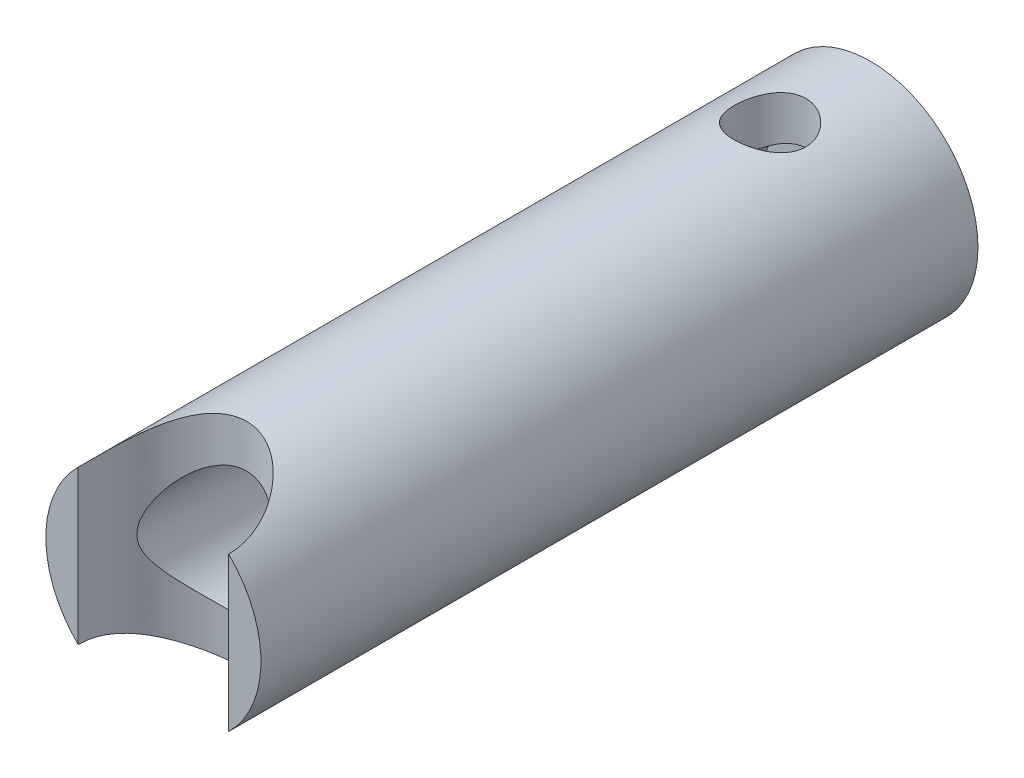
from build123d import *

# Parameters (mm, degrees)
ESQUISSE1_R                  = 7.499999999999999
BOSS_EXTRU_1_DEPTH           = 50
COQUE1_T                     = -3
ESQUISSE2_R                  = 3.25
ENL_V_MAT_EXTRU_1_DEPTH      = 3
ENL_V_START                  = 3.741658222
ENL_V_MAT_EXTRU_2_DEPTH      = 3.758341878
ENL_V_MAT_EXTRU_3_DEPTH      = 52.1126209805562
ENL_V_MAT_EXTRU_3_DEPTH_BACK = 52.1126209805562
ESQUISSE5_RX                 = 6.5
ESQUISSE5_RY                 = 5.25


# Read off the part's stored shape, not the designer's step: Enlèv. mat.-Extru.2
with BuildPart() as part:
    # Esquisse1 → Boss.-Extru.1 (new body)
    with BuildSketch(Plane.XY):
        Circle(ESQUISSE1_R)
    extrude(amount=BOSS_EXTRU_1_DEPTH)

    # Coque1
    coque1_openings = [part.faces().sort_by_distance(p)[0] for p in [
        (0, 0, 50),
    ]]
    offset(amount=COQUE1_T, openings=coque1_openings, kind=Kind.INTERSECTION)

    # Esquisse2 → Enlèv. mat.-Extru.1 (cut)
    with BuildSketch(Plane(origin=(0, 0, 0), x_dir=(-1, 0, 0), z_dir=(0, 0, -1))):
        Circle(ESQUISSE2_R)
    extrude(amount=-ENL_V_MAT_EXTRU_1_DEPTH, mode=Mode.SUBTRACT)

    # Enlèv. mat.-Extru.2 outline → Enlèv. mat.-Extru.2 (cut)
    with BuildSketch(Plane(origin=(0, 0, 0), x_dir=(1, 0, 0), z_dir=(0, 1, 0)).offset(ENL_V_START)):
        with BuildLine():
            add(Edge.make_bspline(
                [(0, -4.5), (-0.665777373921639, -4.5), (-1.3108797918298, -4.77502806566904), (-2.22588234313574, -5.69066668426073), (-2.49954115482472, -6.34073255596721), (-2.50045763095517, -7.65578287810988), (-2.2278471774147, -8.30775806725704), (-1.30741263251952, -9.22804991342628), (-0.656855076796676, -9.49973692434233), (0.654851008774013, -9.5002626740288), (1.30573460063621, -9.2296895812874), (2.22937932360176, -8.306264256457), (2.49994577794749, -7.65925317637901), (2.50005420513552, -6.34115812623399), (2.22645885760644, -5.69117807090988), (1.31005066740923, -4.77426391153354), (0.665777373921637, -4.5), (0, -4.5)],
                knots=[0, 0, 0, 0, 0.125, 0.125, 0.25, 0.25, 0.375, 0.375, 0.5, 0.5, 0.625, 0.625, 0.75, 0.75, 0.875, 0.875, 1, 1, 1, 1], degree=3))
        make_face()
    extrude(amount=ENL_V_MAT_EXTRU_2_DEPTH, mode=Mode.SUBTRACT)

    # Esquisse5 → Enlèv. mat.-Extru.3 (cut, two sides: drawn at the far end of the back side and taken through both)
    with BuildSketch(Plane(origin=(0, 0, 0), x_dir=(1, 0, 0), z_dir=(0, 1, 0)).offset(-ENL_V_MAT_EXTRU_3_DEPTH_BACK)):
        with Locations(Location((0, -50), (0, 0, -90))):
            Ellipse(ESQUISSE5_RX, ESQUISSE5_RY)
    extrude(amount=ENL_V_MAT_EXTRU_3_DEPTH + ENL_V_MAT_EXTRU_3_DEPTH_BACK, mode=Mode.SUBTRACT)


solid = part.part
